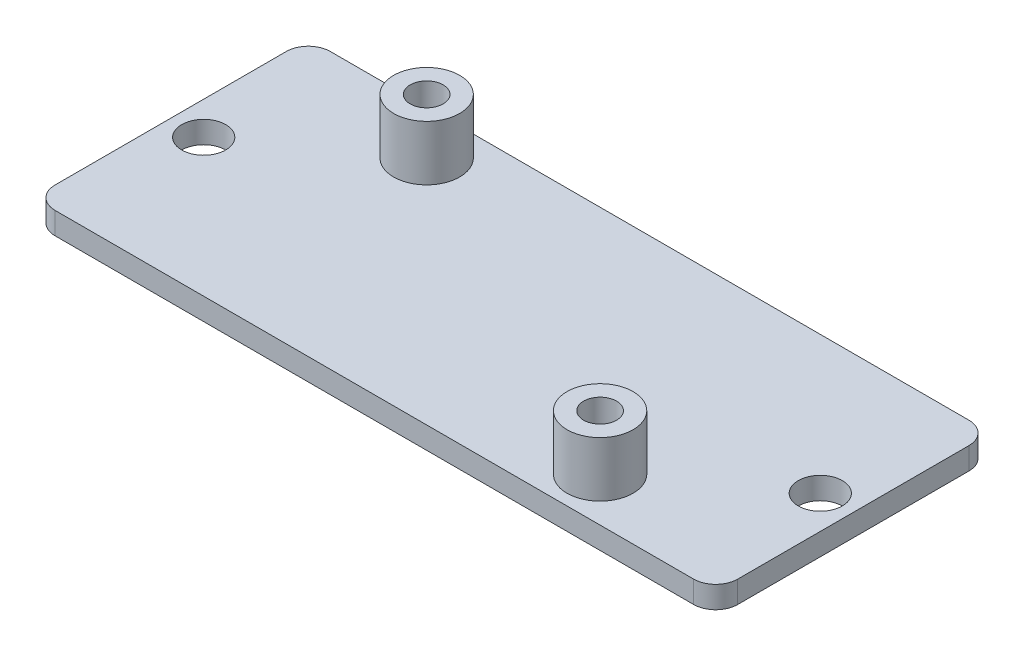
from build123d import *

# Parameters (mm, degrees)
SKETCH_1_W               = 62
SKETCH_1_H               = 25
EXTRUDE_1_DEPTH          = 2
SKETCH_2_R               = 3
EXTRUDE_2_DEPTH          = 5
CUT_EXTRUDE_1_DEPTH      = 68.216069507
CUT_EXTRUDE_1_DEPTH_BACK = 68.216069507
SKETCH_3_R               = 1.5
CUT_EXTRUDE_2_DEPTH      = 68.037303048
CUT_EXTRUDE_2_DEPTH_BACK = 68.037303048
SKETCH_4_R               = 2
FILLET_1_R               = 2
FILLET_2_R               = 2
FILLET_3_R               = 2
FILLET_4_R               = 2


with BuildPart() as part:
    # Эскиз1 → Бобышка-Вытянуть1 (new body)
    with BuildSketch(Plane(origin=(0, 0, 0), x_dir=(1, 0, 0), z_dir=(0, 1, 0))):
        with Locations((31, -12.5)):
            Rectangle(SKETCH_1_W, SKETCH_1_H)
    extrude(amount=EXTRUDE_1_DEPTH)

    # Эскиз2 → Бобышка-Вытянуть2 (add)
    with BuildSketch(Plane(origin=(0, 2, 0), x_dir=(1, 0, 0), z_dir=(0, 1, 0))):
        with Locations((14.75, -4)):
            Circle(SKETCH_2_R)
        with Locations((47.5, -21)):
            Circle(SKETCH_2_R)
    extrude(amount=EXTRUDE_2_DEPTH)

    # Эскиз3 → Вырез-Вытянуть1 (cut, two sides: drawn at the far end of the back side and taken through both)
    with BuildSketch(Plane(origin=(0, 7, 0), x_dir=(1, 0, 0), z_dir=(0, 1, 0)).offset(-CUT_EXTRUDE_1_DEPTH_BACK)):
        with Locations((14.75, -4)):
            Circle(SKETCH_3_R)
        with Locations((47.5, -21)):
            Circle(SKETCH_3_R)
    extrude(amount=CUT_EXTRUDE_1_DEPTH + CUT_EXTRUDE_1_DEPTH_BACK, mode=Mode.SUBTRACT)

    # Эскиз4 → Вырез-Вытянуть2 (cut, two sides: drawn at the far end of the back side and taken through both)
    with BuildSketch(Plane(origin=(0, 2, 0), x_dir=(1, 0, 0), z_dir=(0, 1, 0)).offset(-CUT_EXTRUDE_2_DEPTH_BACK)):
        with Locations((3, -12.5)):
            Circle(SKETCH_4_R)
        with Locations((59, -12.5)):
            Circle(SKETCH_4_R)
    extrude(amount=CUT_EXTRUDE_2_DEPTH + CUT_EXTRUDE_2_DEPTH_BACK, mode=Mode.SUBTRACT)

    # Скругление1
    fillet_1_edges = [part.edges().sort_by_distance(p)[0] for p in [
        (0, 1, 0),
    ]]
    fillet(fillet_1_edges, radius=FILLET_1_R)

    # Скругление2
    fillet_2_edges = [part.edges().sort_by_distance(p)[0] for p in [
        (0, 1, 25),
    ]]
    fillet(fillet_2_edges, radius=FILLET_2_R)

    # Скругление3
    fillet_3_edges = [part.edges().sort_by_distance(p)[0] for p in [
        (62, 1, 25),
    ]]
    fillet(fillet_3_edges, radius=FILLET_3_R)

    # Скругление4
    fillet_4_edges = [part.edges().sort_by_distance(p)[0] for p in [
        (62, 1, 0),
    ]]
    fillet(fillet_4_edges, radius=FILLET_4_R)


solid = part.part
